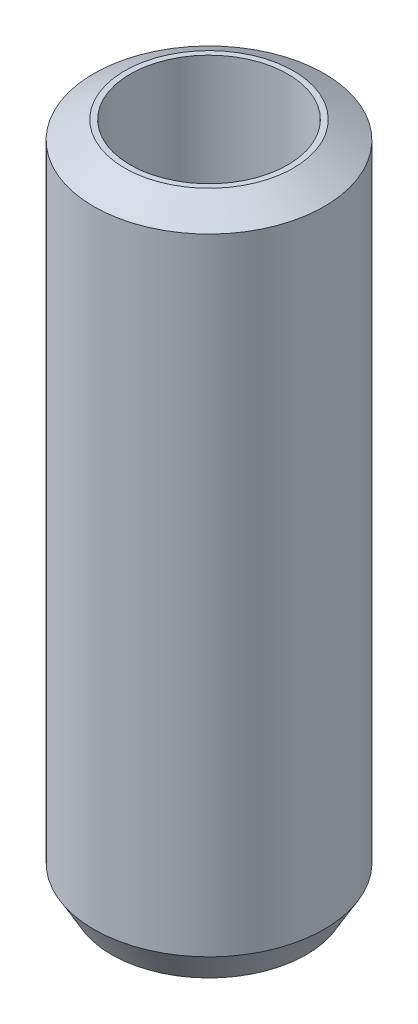
from build123d import *
from OCP.BRepFilletAPI import BRepFilletAPI_MakeChamfer

# Parameters (mm, degrees)
SKETCH1_R           = 10
BOSS_EXTRUDE1_DEPTH = 58.557853047
SKETCH2_R           = 6.838213221
CUT_EXTRUDE1_DEPTH  = 61.2413658
CHAMFER1_SIZE       = 1.547052948
CHAMFER1_SIZE2      = 2.679574307


with BuildPart() as part:
    # Sketch1 → Boss-Extrude1 (new body)
    with BuildSketch(Plane(origin=(0, 0, 0), x_dir=(1, 0, 0), z_dir=(0, 1, 0))):
        Circle(SKETCH1_R)
    extrude(amount=BOSS_EXTRUDE1_DEPTH)

    # Sketch2 → Cut-Extrude1 (cut, through all)
    with BuildSketch(Plane(origin=(0, 0, 0), x_dir=(1, 0, 0), z_dir=(0, 1, 0))):
        Circle(SKETCH2_R)
    extrude(amount=CUT_EXTRUDE1_DEPTH, mode=Mode.SUBTRACT)

    # Chamfer1: one chamfer whose edges measure the first distance from different faces: ONE call of the kernel's chamfer builder (chamfer() names one face for all edges)
    chamfer1_edges_1 = [part.edges().sort_by_distance(p)[0] for p in [
        (-10, 58.557853047, 0),
    ]]
    chamfer1_side_1 = [part.faces().sort_by_distance(p)[0] for p in [
        (-10, 29.278926524, 0),
    ]]
    chamfer1_edges_2 = [part.edges().sort_by_distance(p)[0] for p in [
        (-10, 0, 0),
    ]]
    chamfer1_side_2 = [part.faces().sort_by_distance(p)[0] for p in [
        (-9.717157288, 0, 0),
    ]]
    chamfer1 = BRepFilletAPI_MakeChamfer(part.part.solid().wrapped)
    for e in chamfer1_edges_1:
        chamfer1.Add(CHAMFER1_SIZE, CHAMFER1_SIZE2, e.wrapped, chamfer1_side_1[0].wrapped)  # the first distance lies on this face
    for e in chamfer1_edges_2:
        chamfer1.Add(CHAMFER1_SIZE, CHAMFER1_SIZE2, e.wrapped, chamfer1_side_2[0].wrapped)  # the first distance lies on this face
    add(Compound.cast(chamfer1.Shape()), mode=Mode.REPLACE)


solid = part.part
